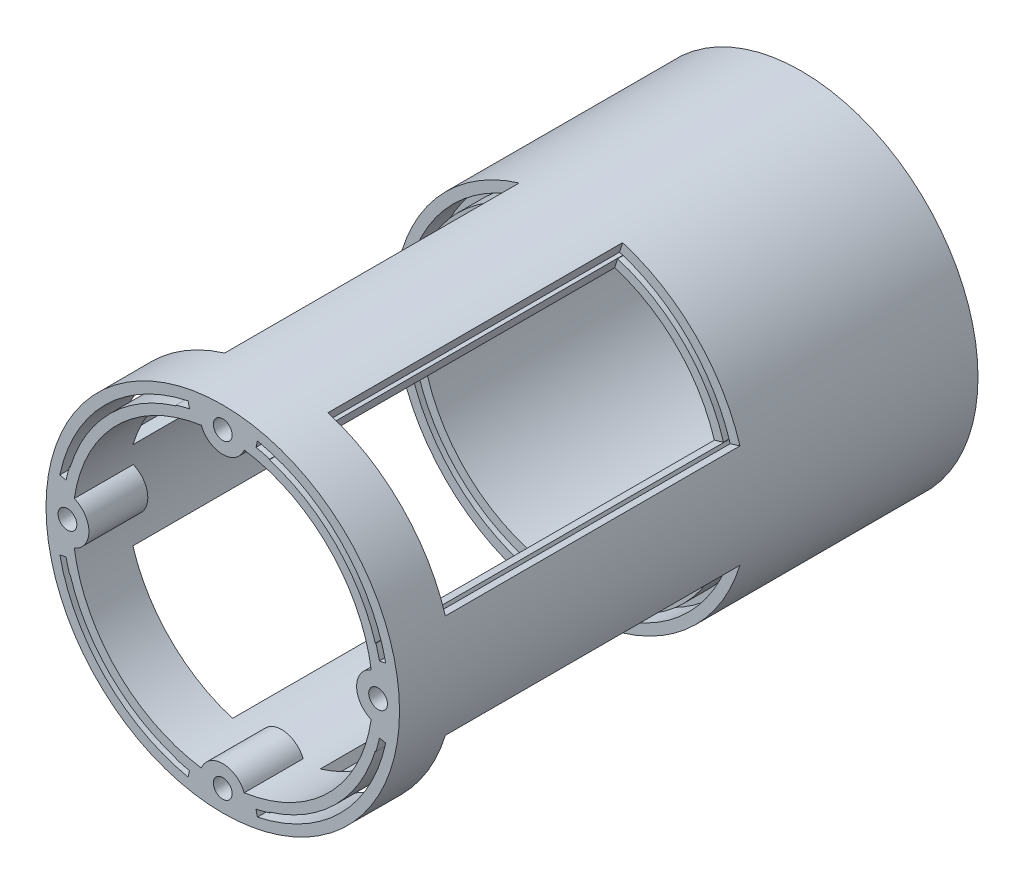
from build123d import *

# Parameters (mm, degrees)
CROQUIS1_R               = 33
CROQUIS1_R_2             = 28
BOSS_EXTRUDE1_DEPTH      = 108
CORTAR_EXTRUIR1_DEPTH    = 70
CORTAR_REVOLUCI_N2_ANGLE = 56
MATRIZC2_COUNT           = 4
BOSS_EXTRUDE4_DEPTH      = 11
SKETCH9_R                = 1.75
CUT_EXTRUDE3_DEPTH       = 10


with BuildPart() as part:
    # Croquis1 → Boss-Extrude1 (new body)
    with BuildSketch(Plane.XY):
        Circle(CROQUIS1_R)
        Circle(CROQUIS1_R_2, mode=Mode.SUBTRACT)
    extrude(amount=BOSS_EXTRUDE1_DEPTH)

    # Croquis2 → Cortar-Extruir1 (cut)
    with BuildSketch(Plane.XY.offset(108)):
        with BuildLine():
            Line((-30.420390383, -6.466053584), (-29.246613262, -6.216559555))
            ThreePointArc((-29.246613262, -6.216559555), (-21.142492757, -21.142492757), (-6.216559555, -29.246613262))
            Line((-6.216559555, -29.246613262), (-6.466053584, -30.420390383))
            ThreePointArc((-6.466053584, -30.420390383), (-21.991020895, -21.991020895), (-30.420390383, -6.466053584))
        make_face()
        with BuildLine():
            Line((-30.420390383, 6.466053584), (-29.246613262, 6.216559555))
            ThreePointArc((-29.246613262, 6.216559555), (-21.142492757, 21.142492757), (-6.216559555, 29.246613262))
            Line((-6.216559555, 29.246613262), (-6.466053584, 30.420390383))
            ThreePointArc((-6.466053584, 30.420390383), (-21.991020895, 21.991020895), (-30.420390383, 6.466053584))
        make_face()
        with BuildLine():
            Line((6.466053584, 30.420390383), (6.216559555, 29.246613262))
            ThreePointArc((6.216559555, 29.246613262), (21.142492757, 21.142492757), (29.246613262, 6.216559555))
            Line((29.246613262, 6.216559555), (30.420390383, 6.466053584))
            ThreePointArc((30.420390383, 6.466053584), (21.991020895, 21.991020895), (6.466053584, 30.420390383))
        make_face()
        with BuildLine():
            Line((30.420390383, -6.466053584), (29.246613262, -6.216559555))
            ThreePointArc((29.246613262, -6.216559555), (21.142492757, -21.142492757), (6.216559555, -29.246613262))
            Line((6.216559555, -29.246613262), (6.466053584, -30.420390383))
            ThreePointArc((6.466053584, -30.420390383), (21.991020895, -21.991020895), (30.420390383, -6.466053584))
        make_face()
    extrude(amount=-CORTAR_EXTRUIR1_DEPTH, mode=Mode.SUBTRACT)

    # Croquis4 → Cortar-Revolución2 (revolve, cut)
    with BuildSketch(Plane(origin=(0, 0, 0), x_dir=(0, 0, -1), z_dir=(0.9563047559630335, -0.29237170472274326, 0))):
        Polygon((-98, 33), (-98, 30.983938292), (-108, 30.983938292), (-108, 29.783938292), (-98, 29.783938292), (-98, 27.767876584), (-43, 27.767876584), (-43, 29.783938292), (-38, 29.783938292), (-38, 30.983938292), (-43, 30.983938292), (-43, 33), align=None)
    cortar_revoluci_n2 = revolve(axis=Axis((0, 0, 108), (0, 0, -1)), revolution_arc=CORTAR_REVOLUCI_N2_ANGLE, mode=Mode.SUBTRACT)

    # MatrizC2: Cortar-Revolución2 ×4 about axis
    matrizc2_axis = Axis((0, 0, 108), (0, 0, -1))
    for i in range(1, MATRIZC2_COUNT):
        add(cortar_revoluci_n2.rotate(matrizc2_axis, i * 360 / MATRIZC2_COUNT), mode=Mode.SUBTRACT)

    # Sketch8 → Boss-Extrude4 (add)
    with BuildSketch(Plane(origin=(0, 0, 0), x_dir=(-1, 0, 0), z_dir=(0, 0, -1))):
        with BuildLine():
            ThreePointArc((-4, -27.712812921), (0, -28), (4, -27.712812921))
            ThreePointArc((4, -27.712812921), (0, -24.990786305), (-4, -27.712812921))
        make_face()
        with BuildLine():
            ThreePointArc((-27.712812921, 4), (-28, 0), (-27.712812921, -4))
            ThreePointArc((-27.712812921, -4), (-24.990786305, 0), (-27.712812921, 4))
        make_face()
        with BuildLine():
            ThreePointArc((4, 27.712812921), (0, 28), (-4, 27.712812921))
            ThreePointArc((-4, 27.712812921), (0, 24.990786305), (4, 27.712812921))
        make_face()
        with BuildLine():
            ThreePointArc((27.712812921, -4), (28, 0), (27.712812921, 4))
            ThreePointArc((27.712812921, 4), (24.990786305, 0), (27.712812921, -4))
        make_face()
    boss_extrude4 = extrude(amount=-BOSS_EXTRUDE4_DEPTH)

    # Sketch9 → Cut-Extrude3 (cut)
    with BuildSketch(Plane(origin=(0, 0, 0), x_dir=(-1, 0, 0), z_dir=(0, 0, -1))):
        with Locations((0, -29)):
            Circle(SKETCH9_R)
        with Locations((-29, 0)):
            Circle(SKETCH9_R)
        with Locations((0, 29)):
            Circle(SKETCH9_R)
        with Locations((29, 0)):
            Circle(SKETCH9_R)
    cut_extrude3 = extrude(amount=-CUT_EXTRUDE3_DEPTH, mode=Mode.SUBTRACT)

    # Mirror1: Boss-Extrude4, Cut-Extrude3 across plane
    add(boss_extrude4.mirror(Plane.XY.offset(54)))
    add(cut_extrude3.mirror(Plane.XY.offset(54)), mode=Mode.SUBTRACT)


solid = part.part
